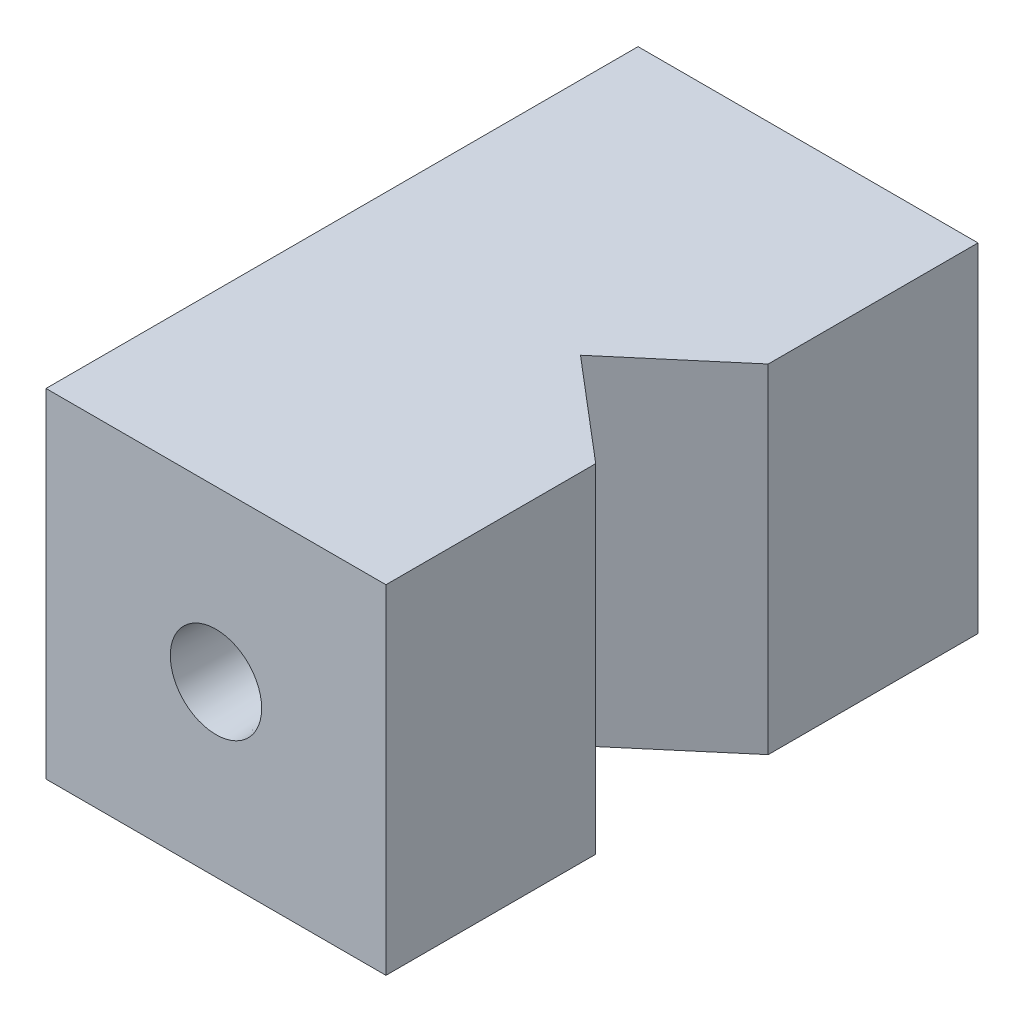
from build123d import *

# Parameters (mm, degrees)
BOSS_EXTRUDE1_START       = 0.2
SKETCH2_R                 = 30
BOSS_EXTRUDE1_DEPTH       = 20
CUT_EXTRUDE2_DEPTH        = 47.904157598
SKETCH4_W                 = 60
SKETCH4_H                 = 60
SKETCH4_W_2               = 22.366985862
SKETCH4_H_2               = 35
CUT_EXTRUDE3_DEPTH        = 47.904157598
SKETCH11_W                = 2.27
SKETCH11_H                = 37.5
CUT_EXTRUDE4_DEPTH        = 37.055512755
HOLE1_D                   = 4.8
HOLE1_DEPTH               = 10
HOLE1_CBORE_D             = 5.4
HOLE1_CBORE_DEPTH         = 6
CHAMFER1_SIZE2            = 0.3
CHAMFER1_SIZE             = 6
CHAMFER1_OF_MIRROR1_SIZE2 = 0.3
CHAMFER1_OF_MIRROR1_SIZE  = 6


with BuildPart() as part:
    # Sketch2 → Boss-Extrude1 (new body)
    with BuildSketch(Plane(origin=(0, 0, 0), x_dir=(1, 0, 0), z_dir=(0, 1, 0)).offset(BOSS_EXTRUDE1_START)):
        with Locations(Location((0, 0, 0), (0, 0, 270))):
            Circle(SKETCH2_R)
    extrude(amount=BOSS_EXTRUDE1_DEPTH)

    # Sketch3 → Cut-Extrude2 (cut, through all)
    with BuildSketch(Plane(origin=(0, 20.2, 0), x_dir=(1, 0, 0), z_dir=(0, 1, 0))):
        with BuildLine():
            ThreePointArc((0, -17.5), (17.5, 0), (0, 17.5))
            Line((0, 17.5), (-2, 17.5))
            Line((-2, 17.5), (-2, 9.06190379))
            Line((-2, 9.06190379), (-2, 5.1))
            Line((-2, 5.1), (-8, 0))
            Line((-8, 0), (-2, -5.1))
            Line((-2, -5.1), (-2, -9.06190379))
            Line((-2, -9.06190379), (-2, -17.5))
            Line((-2, -17.5), (0, -17.5))
        make_face()
    extrude(amount=-CUT_EXTRUDE2_DEPTH, mode=Mode.SUBTRACT)

    # Sketch4 → Cut-Extrude3 (cut, through all)
    with BuildSketch(Plane(origin=(0, 20.2, 0), x_dir=(1, 0, 0), z_dir=(0, 1, 0))):
        Rectangle(SKETCH4_W, SKETCH4_H)
        with Locations((-13.183492931, 0)):
            Rectangle(SKETCH4_W_2, SKETCH4_H_2, mode=Mode.SUBTRACT)
    extrude(amount=-CUT_EXTRUDE3_DEPTH, mode=Mode.SUBTRACT)

    # Sketch11 → Cut-Extrude4 (cut, through all)
    with BuildSketch(Plane(origin=(0, 20.2, 0), x_dir=(1, 0, 0), z_dir=(0, 1, 0))):
        with Locations((-23.231985862, -1.25)):
            Rectangle(SKETCH11_W, SKETCH11_H)
    extrude(amount=-CUT_EXTRUDE4_DEPTH, mode=Mode.SUBTRACT)

    # Hole1
    with Locations(Plane.XY.offset(17.5)):
        with Locations((-12.048492931, 10.2)):
            hole1 = CounterBoreHole(HOLE1_D / 2, HOLE1_CBORE_D / 2, HOLE1_CBORE_DEPTH, depth=HOLE1_DEPTH)

    # Chamfer1
    chamfer1_edges = [part.edges().sort_by_distance(p)[0] for p in [
        (-14.748492931, 10.2, 11.5),
    ]]
    chamfer1_side = [part.faces().sort_by_distance(p)[0] for p in [
        (-14.748492931, 10.2, 11.506),
    ]]
    chamfer(chamfer1_edges, length=CHAMFER1_SIZE - 0.0001, length2=CHAMFER1_SIZE2 - 0.0001, reference=chamfer1_side[0])  # a hair under: the kernel refuses the full size

    # Mirror1: Hole1 across plane
    add(hole1.mirror(Plane.XY), mode=Mode.SUBTRACT)

    # Chamfer1 of Mirror1
    chamfer1_of_mirror1_edges = [part.edges().sort_by_distance(p)[0] for p in [
        (-14.748492931, 10.2, -11.5),
    ]]
    chamfer1_of_mirror1_side = [part.faces().sort_by_distance(p)[0] for p in [
        (-14.748492931, 10.2, -11.506),
    ]]
    chamfer(chamfer1_of_mirror1_edges, length=CHAMFER1_OF_MIRROR1_SIZE - 0.0001, length2=CHAMFER1_OF_MIRROR1_SIZE2 - 0.0001, reference=chamfer1_of_mirror1_side[0])  # a hair under: the kernel refuses the full size


solid = part.part
